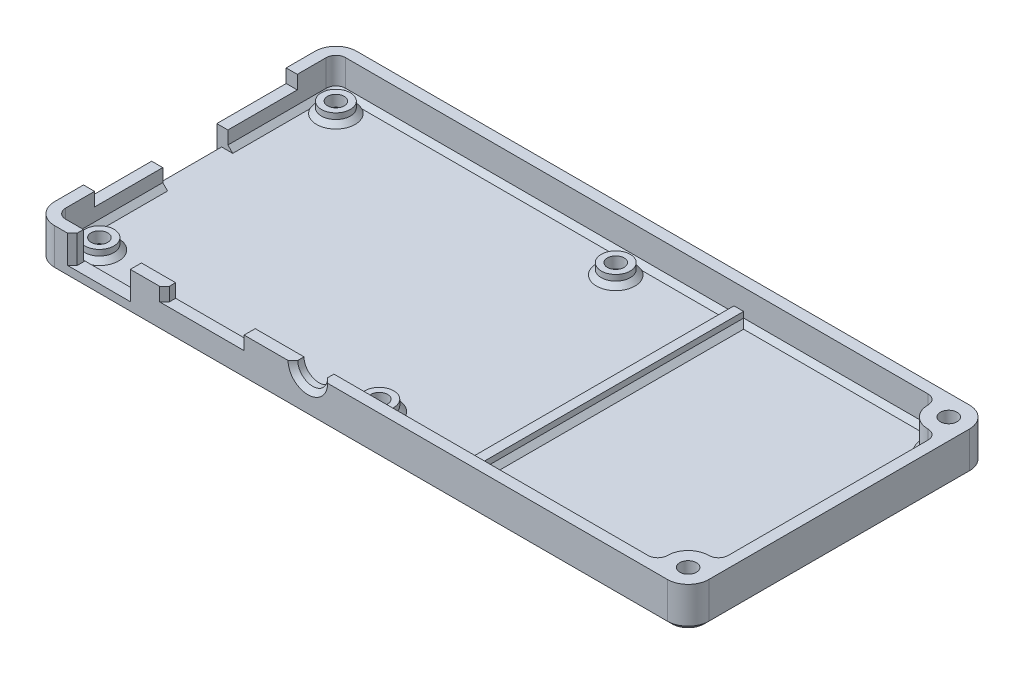
from build123d import *

# Parameters (mm, degrees)
SKETCH3_W                                         = 135.6
SKETCH3_H                                         = 62.6
SKETCH3_W_2                                       = 131
SKETCH3_H_2                                       = 58
BOSS_EXTRUDE1_DEPTH                               = 8.5
SKETCH5_W                                         = 131
SKETCH5_H                                         = 58
BOSS_EXTRUDE2_DEPTH                               = 2
SKETCH6_R                                         = 3
BOSS_EXTRUDE3_DEPTH                               = 2.2
SKETCH10_W                                        = 2
SKETCH10_H                                        = 58
BOSS_EXTRUDE4_DEPTH                               = 2.2
CUT_EXTRUDE1_REACH                                = 99.956
SKETCH11_R                                        = 3.1
SKETCH11_W                                        = 12
SKETCH11_H                                        = 5.8
SKETCH11_W_2                                      = 16.5
SKETCH11_H_2                                      = 2.8
CUT_EXTRUDE2_REACH                                = 142.155
SKETCH12_W                                        = 42
SKETCH12_H                                        = 2.8
SKETCH12_W_2                                      = 13.5
SKETCH12_H_2                                      = 3.7
FILLET6_R                                         = 2
FILLET8_R                                         = 2
CHAMFER1_SIZE                                     = 1
SKETCH24_R                                        = 4.3
BOSS_EXTRUDE7_DEPTH                               = 6.5
FILLET21_R                                        = 2
FILLET22_R                                        = 2
FILLET20_R                                        = 4.3
CHAMFER5_SIZE                                     = 1
CSK_FOR_4_FLAT_HEAD_SOCKET_CAP_SCREW1_D           = 3.4544
CSK_FOR_4_FLAT_HEAD_SOCKET_CAP_SCREW1_DEPTH       = 14
CSK_FOR_4_FLAT_HEAD_SOCKET_CAP_SCREW1_CSINK_D     = 6.723761
CSK_FOR_4_FLAT_HEAD_SOCKET_CAP_SCREW1_CSINK_ANGLE = 82
CSK_FOR_4_FLAT_HEAD_SOCKET_CAP_SCREW1_TIP         = 1.037806461
CHAMFER6_SIZE                                     = 1
CHAMFER7_SIZE                                     = 1
CHAMFER8_SIZE                                     = 1


# Some blends are built 0.0001 mm under size
with BuildPart() as part:
    # Sketch3 → Boss-Extrude1 (new body)
    with BuildSketch(Plane(origin=(0, 0, 0), x_dir=(1, 0, 0), z_dir=(0, 1, 0))):
        with Locations((-7.061766162, 3.105993834)):
            Rectangle(SKETCH3_W, SKETCH3_H)
        with Locations((-7.061766162, 3.105993834)):
            Rectangle(SKETCH3_W_2, SKETCH3_H_2, mode=Mode.SUBTRACT)
    extrude(amount=BOSS_EXTRUDE1_DEPTH)

    # Sketch5 → Boss-Extrude2 (add)
    with BuildSketch(Plane(origin=(0, 0, 0), x_dir=(1, 0, 0), z_dir=(0, 1, 0))):
        with Locations((-7.061766162, 3.105993834)):
            Rectangle(SKETCH5_W, SKETCH5_H)
    extrude(amount=BOSS_EXTRUDE2_DEPTH)

    # Sketch6 → Boss-Extrude3 (add)
    with BuildSketch(Plane(origin=(0, 2, 0), x_dir=(1, 0, 0), z_dir=(0, 1, 0))):
        with Locations(Location((-68.061766162, 27.605993834, 0), (0, 0, 270))):
            Circle(SKETCH6_R)
        with Locations(Location((-68.061766162, -21.394006166, 0), (0, 0, 270))):
            Circle(SKETCH6_R)
        with Locations(Location((-10.061766162, -21.394006166, 0), (0, 0, 270))):
            Circle(SKETCH6_R)
        with Locations(Location((-10.061766162, 27.605993834, 0), (0, 0, 270))):
            Circle(SKETCH6_R)
    extrude(amount=BOSS_EXTRUDE3_DEPTH)

    # Sketch10 → Boss-Extrude4 (add)
    with BuildSketch(Plane(origin=(0, 2, 0), x_dir=(1, 0, 0), z_dir=(0, 1, 0))):
        with Locations((10.938233838, 3.105993834)):
            Rectangle(SKETCH10_W, SKETCH10_H)
    extrude(amount=BOSS_EXTRUDE4_DEPTH)

    # Sketch11 → Cut-Extrude1 (cut, up to next)
    with BuildSketch(Plane.XY.offset(28.194006166), mode=Mode.PRIVATE) as cut_extrude1_sk1:
        with Locations((-18.061766162, 8.5)):
            Circle(SKETCH11_R)
    cut_extrude1_tool1 = extrude(cut_extrude1_sk1.sketch, amount=-CUT_EXTRUDE1_REACH, mode=Mode.PRIVATE) & part.part
    # Sketch11 → Cut-Extrude1 (cut, up to next)
    with BuildSketch(Plane.XY.offset(28.194006166), mode=Mode.PRIVATE) as cut_extrude1_sk2:
        with Locations((-60.861766162, 5.6)):
            Rectangle(SKETCH11_W, SKETCH11_H)
    cut_extrude1_tool2 = extrude(cut_extrude1_sk2.sketch, amount=-CUT_EXTRUDE1_REACH, mode=Mode.PRIVATE) & part.part
    # Sketch11 → Cut-Extrude1 (cut, up to next)
    with BuildSketch(Plane.XY.offset(28.194006166), mode=Mode.PRIVATE) as cut_extrude1_sk3:
        with Locations((-39.527982648, 7.1)):
            Rectangle(SKETCH11_W_2, SKETCH11_H_2)
    cut_extrude1_tool3 = extrude(cut_extrude1_sk3.sketch, amount=-CUT_EXTRUDE1_REACH, mode=Mode.PRIVATE) & part.part
    add(cut_extrude1_tool1.solids().sort_by_distance((-18.061766, 8.5, 28.194006))[0], mode=Mode.SUBTRACT)
    add(cut_extrude1_tool2.solids().sort_by_distance((-60.861766, 5.6, 28.194006))[0], mode=Mode.SUBTRACT)
    add(cut_extrude1_tool3.solids().sort_by_distance((-39.527983, 7.1, 28.194006))[0], mode=Mode.SUBTRACT)

    # Sketch12 → Cut-Extrude2 (cut, up to next)
    with BuildSketch(Plane.ZY.offset(74.861766162), mode=Mode.PRIVATE) as cut_extrude2_sk1:
        with Locations((-3.105993834, 7.1)):
            Rectangle(SKETCH12_W, SKETCH12_H)
    cut_extrude2_tool1 = extrude(cut_extrude2_sk1.sketch, amount=-CUT_EXTRUDE2_REACH, mode=Mode.PRIVATE) & part.part
    # Sketch12 → Cut-Extrude2 (cut, up to next)
    with BuildSketch(Plane.ZY.offset(74.861766162), mode=Mode.PRIVATE) as cut_extrude2_sk2:
        with Locations((-2.982922372, 3.85)):
            Rectangle(SKETCH12_W_2, SKETCH12_H_2)
    cut_extrude2_tool2 = extrude(cut_extrude2_sk2.sketch, amount=-CUT_EXTRUDE2_REACH, mode=Mode.PRIVATE) & part.part
    add(cut_extrude2_tool1.solids().sort_by_distance((-74.861766, 7.1, -3.105994))[0], mode=Mode.SUBTRACT)
    add(cut_extrude2_tool2.solids().sort_by_distance((-74.861766, 3.85, -2.982922))[0], mode=Mode.SUBTRACT)

    # Fillet6
    fillet6_edges = [part.edges().sort_by_distance(p)[0] for p in [
        (58.438233838, 5.25, -32.105993834),
    ]]
    fillet(fillet6_edges, radius=FILLET6_R)

    # Fillet8
    fillet8_edges = [part.edges().sort_by_distance(p)[0] for p in [
        (-72.561766162, 5.25, -32.105993834),
        (-72.561766162, 5.25, 25.894006166),
    ]]
    fillet(fillet8_edges, radius=FILLET8_R)

    # Chamfer1
    chamfer1_edges = [part.edges().sort_by_distance(p)[0] for p in [
        (-68.061766162, 2, -30.605993834),
        (-68.061766162, 2, 18.394006166),
        (-10.061766162, 2, 18.394006166),
        (-10.061766162, 2, -30.605993834),
    ]]
    chamfer(chamfer1_edges, length=CHAMFER1_SIZE)

    # Sketch24 → Boss-Extrude7 (add)
    with BuildSketch(Plane(origin=(0, 2, 0), x_dir=(1, 0, 0), z_dir=(0, 1, 0))):
        with Locations((56.438233838, -23.894006166)):
            Circle(SKETCH24_R)
        with Locations((56.438233838, 30.105993834)):
            Circle(SKETCH24_R)
    extrude(amount=BOSS_EXTRUDE7_DEPTH)

    # Fillet21
    fillet21_edges = [part.edges().sort_by_distance(p)[0] for p in [
        (52.631660576, 5.25, 25.894006166),
    ]]
    fillet(fillet21_edges, radius=FILLET21_R)

    # Fillet22
    fillet22_edges = [part.edges().sort_by_distance(p)[0] for p in [
        (58.438233838, 5.25, 20.087432904),
        (58.438233838, 5.25, -26.299420572),
        (52.631660576, 5.25, -32.105993834),
    ]]
    fillet(fillet22_edges, radius=FILLET22_R)

    # Fillet20
    fillet20_edges = [part.edges().sort_by_distance(p)[0] for p in [
        (-74.861766162, 4.25, -34.405993834),
        (60.738233838, 4.25, -34.405993834),
        (60.738233838, 4.25, 28.194006166),
        (-74.861766162, 4.25, 28.194006166),
    ]]
    fillet(fillet20_edges, radius=FILLET20_R - 0.0001)  # a hair under: the kernel refuses the full size

    # Chamfer5
    # the kernel refuses this chamfer: 1 mm, written as the material it adds along each edge
    with BuildSketch(Plane(origin=(-72.561766162, 2, 23.894006166), x_dir=(0.9996219169112968, -0.027495876610586605, 0), z_dir=(0, 0, -1))) as chamfer5_piece_1:
        Polygon((CHAMFER5_SIZE * 0.999621916911, -CHAMFER5_SIZE * 0.0274958766106), (-CHAMFER5_SIZE * 0.0274958766106, -CHAMFER5_SIZE * 0.999621916911), (0, 0), align=None)
    extrude(amount=20.126928538)
    with BuildSketch(Plane(origin=(-72.561766162, 2, -9.732922372), x_dir=(-0.02749587661058217, 0.9996219169112968, 0), z_dir=(0, 0, -1))) as chamfer5_piece_2:
        Polygon((CHAMFER5_SIZE * 0.999621916911, CHAMFER5_SIZE * 0.0274958766106), (-CHAMFER5_SIZE * 0.0274958766106, CHAMFER5_SIZE * 0.999621916911), (0, 0), align=None)
    extrude(amount=20.373071462)
    with BuildSketch(Plane(origin=(-70.561766162, 2, 23.894006166), x_dir=(0, 0, 1), z_dir=(1, 0, 0))) as chamfer5_piece_3:
        Polygon((2 - CHAMFER5_SIZE, 0), (2, -CHAMFER5_SIZE), (2, 0), align=None)
    revolve(axis=Axis((-70.561766162, 2, 23.894006166), (0, -1, 0)), revolution_arc=90)
    with BuildSketch(Plane(origin=(-70.561766162, 2, -30.105993834), x_dir=(0, 0, -1), z_dir=(1, 0, 0))) as chamfer5_piece_4:
        Polygon((2, CHAMFER5_SIZE), (2 - CHAMFER5_SIZE, 0), (2, 0), align=None)
    revolve(axis=Axis((-70.561766162, 2, -30.105993834), (0, 1, 0)), revolution_arc=90)
    with BuildSketch(Plane(origin=(12.509916826, 2, 25.894006166), x_dir=(0, 0.9996219169112968, 0.027495876610585623), z_dir=(-1, 0, 0))) as chamfer5_piece_5_section:
        Polygon((CHAMFER5_SIZE * 0.999621916911, CHAMFER5_SIZE * 0.0274958766106), (-CHAMFER5_SIZE * 0.0274958766106, CHAMFER5_SIZE * 0.999621916911), (0, 0), align=None)
    chamfer5_piece_5 = extrude(amount=83.071682988, mode=Mode.PRIVATE)
    chamfer5_piece_5 = split(chamfer5_piece_5, bisect_by=Plane(origin=(-54.861766162, 2.8, 25.794006166), z_dir=(1, 0, 0)), keep=Keep.TOP, mode=Mode.PRIVATE)
    add(chamfer5_piece_5)
    with BuildSketch(Plane(origin=(12.509916826, 2, 25.894006166), x_dir=(0, 0.9996219169112968, 0.027495876610585623), z_dir=(-1, 0, 0))) as chamfer5_piece_6_section:
        Polygon((CHAMFER5_SIZE * 0.999621916911, CHAMFER5_SIZE * 0.0274958766106), (-CHAMFER5_SIZE * 0.0274958766106, CHAMFER5_SIZE * 0.999621916911), (0, 0), align=None)
    chamfer5_piece_6 = extrude(amount=83.071682988, mode=Mode.PRIVATE)
    chamfer5_piece_6 = split(chamfer5_piece_6, bisect_by=Plane(origin=(-60.854561902, 2.7, 25.53824485), z_dir=(0, -1, 0)), keep=Keep.TOP, mode=Mode.PRIVATE)
    add(chamfer5_piece_6)
    with BuildSketch(Plane(origin=(12.509916826, 2, 25.894006166), x_dir=(0, 0.9996219169112968, 0.027495876610585623), z_dir=(-1, 0, 0))) as chamfer5_piece_7_section:
        Polygon((CHAMFER5_SIZE * 0.999621916911, CHAMFER5_SIZE * 0.0274958766106), (-CHAMFER5_SIZE * 0.0274958766106, CHAMFER5_SIZE * 0.999621916911), (0, 0), align=None)
    chamfer5_piece_7 = extrude(amount=83.071682988, mode=Mode.PRIVATE)
    chamfer5_piece_7 = split(chamfer5_piece_7, bisect_by=Plane(origin=(-66.861766162, 2.802568974, 25.79914411), z_dir=(-1, 0, 0)), keep=Keep.TOP, mode=Mode.PRIVATE)
    add(chamfer5_piece_7)
    with BuildSketch(Plane(origin=(-70.561766162, 2, -32.105993834), x_dir=(0, 0.9996219169112968, -0.027495876610589075), z_dir=(1, 0, 0))) as chamfer5_piece_8:
        Polygon((CHAMFER5_SIZE * 0.999621916911, CHAMFER5_SIZE * 0.0274958766106), (-CHAMFER5_SIZE * 0.0274958766106, CHAMFER5_SIZE * 0.999621916911), (0, 0), align=None)
    extrude(amount=83.071682988)
    with BuildSketch(Plane(origin=(9.938233838, 2, 25.894006166), x_dir=(0.027495876610585623, 0.9996219169112968, 0), z_dir=(0, 0, -1))) as chamfer5_piece_9:
        Polygon((CHAMFER5_SIZE * 0.999621916911, -CHAMFER5_SIZE * 0.0274958766106), (-CHAMFER5_SIZE * 0.0274958766106, -CHAMFER5_SIZE * 0.999621916911), (0, 0), align=None)
    extrude(amount=58)
    with BuildSketch(Plane(origin=(11.938233838, 2, -32.105993834), x_dir=(0.9996219169112968, -0.027495876610586296, 0), z_dir=(0, 0, 1))) as chamfer5_piece_10:
        Polygon((CHAMFER5_SIZE * 0.999621916911, CHAMFER5_SIZE * 0.0274958766106), (-CHAMFER5_SIZE * 0.0274958766106, CHAMFER5_SIZE * 0.999621916911), (0, 0), align=None)
    extrude(amount=58)
    with BuildSketch(Plane(origin=(9.36655085, 2, -32.105993834), x_dir=(0, 0.9996219169112968, -0.027495876610589075), z_dir=(1, 0, 0)), Plane(origin=(50.138233838, 2, 25.894006166), x_dir=(0, 0.9996219169112968, 0.027495876610585623), z_dir=(-1, 0, 0))) as chamfer5_piece_11:
        Polygon((CHAMFER5_SIZE * 0.999621916911, CHAMFER5_SIZE * 0.0274958766106), (-CHAMFER5_SIZE * 0.0274958766106, CHAMFER5_SIZE * 0.999621916911), (0, 0), align=None)
    extrude(amount=40.771682988)
    with BuildSketch(Plane(origin=(56.438233838, 2, 23.894006166), x_dir=(0, 0, -1), z_dir=(1, 0, 0))) as chamfer5_piece_12:
        Polygon((4.3, CHAMFER5_SIZE), (4.3 + CHAMFER5_SIZE, 0), (4.3, 0), align=None)
    revolve(axis=Axis((56.438233838, 2, 23.894006166), (0, 1, 0)), revolution_arc=90)
    with BuildSketch(Plane(origin=(58.438233838, 2, -23.805993834), x_dir=(0.02749587661059598, 0.9996219169112965, 0), z_dir=(0, 0, 1))) as chamfer5_piece_13:
        Polygon((CHAMFER5_SIZE * 0.999621916911, CHAMFER5_SIZE * 0.0274958766106), (-CHAMFER5_SIZE * 0.0274958766106, CHAMFER5_SIZE * 0.999621916911), (0, 0), align=None)
    extrude(amount=41.4)
    with BuildSketch(Plane(origin=(56.438233838, 2, -30.105993834), x_dir=(-1, 0, 0), z_dir=(0, 0, -1))) as chamfer5_piece_14:
        Polygon((4.3, CHAMFER5_SIZE), (4.3 + CHAMFER5_SIZE, 0), (4.3, 0), align=None)
    revolve(axis=Axis((56.438233838, 2, -30.105993834), (0, 1, 0)), revolution_arc=90)
    with BuildSketch(Plane(origin=(50.138233838, 2, 23.894006166), x_dir=(0, 0, 1), z_dir=(-1, 0, 0))) as chamfer5_piece_15:
        Polygon((2, CHAMFER5_SIZE), (2 - CHAMFER5_SIZE, 0), (2, 0), align=None)
    revolve(axis=Axis((50.138233838, 2, 23.894006166), (0, 1, 0)), revolution_arc=90)
    with BuildSketch(Plane(origin=(56.438233838, 2, 17.594006166), x_dir=(0, 0, 1), z_dir=(-1, 0, 0))) as chamfer5_piece_16:
        Polygon((2, CHAMFER5_SIZE), (2 - CHAMFER5_SIZE, 0), (2, 0), align=None)
    revolve(axis=Axis((56.438233838, 2, 17.594006166), (0, 1, 0)), revolution_arc=90)
    with BuildSketch(Plane(origin=(56.438233838, 2, -23.805993834), x_dir=(1, 0, 0), z_dir=(0, 0, 1))) as chamfer5_piece_17:
        Polygon((2, CHAMFER5_SIZE), (2 - CHAMFER5_SIZE, 0), (2, 0), align=None)
    revolve(axis=Axis((56.438233838, 2, -23.805993834), (0, 1, 0)), revolution_arc=90)
    with BuildSketch(Plane(origin=(50.138233838, 2, -30.105993834), x_dir=(0, 0, -1), z_dir=(-1, 0, 0))) as chamfer5_piece_18:
        Polygon((2, -CHAMFER5_SIZE), (2 - CHAMFER5_SIZE, 0), (2, 0), align=None)
    revolve(axis=Axis((50.138233838, 2, -30.105993834), (0, -1, 0)), revolution_arc=90)

    # CSK for #4 Flat Head Socket Cap Screw1
    with Locations(Plane(origin=(0, 0, 0), x_dir=(-1, 0, 0), z_dir=(0, -1, 0))):
        with Locations((68.061766162, 27.605993834), (68.061766162, -21.394006166), (-56.438233838, 30.105993834), (-56.438233838, -23.894006166), (10.061766162, -21.394006166), (10.061766162, 27.605993834)):
            CounterSinkHole(CSK_FOR_4_FLAT_HEAD_SOCKET_CAP_SCREW1_D / 2, CSK_FOR_4_FLAT_HEAD_SOCKET_CAP_SCREW1_CSINK_D / 2, depth=CSK_FOR_4_FLAT_HEAD_SOCKET_CAP_SCREW1_DEPTH, counter_sink_angle=CSK_FOR_4_FLAT_HEAD_SOCKET_CAP_SCREW1_CSINK_ANGLE)
            with Locations((0, 0, -(CSK_FOR_4_FLAT_HEAD_SOCKET_CAP_SCREW1_DEPTH + CSK_FOR_4_FLAT_HEAD_SOCKET_CAP_SCREW1_TIP / 2))):  # 118° drill point
                Cone(0, CSK_FOR_4_FLAT_HEAD_SOCKET_CAP_SCREW1_D / 2, CSK_FOR_4_FLAT_HEAD_SOCKET_CAP_SCREW1_TIP, mode=Mode.SUBTRACT)

    # Chamfer6
    chamfer6_edges = [part.edges().sort_by_distance(p)[0] for p in [
        (-18.061766162, 5.4, 28.194006166),
        (-66.861766162, 5.6, 28.194006166),
        (-47.777982648, 7.1, 28.194006166),
    ]]
    chamfer(chamfer6_edges, length=CHAMFER6_SIZE)

    # Chamfer7
    # the kernel refuses this chamfer: 1 mm, written as the material it takes off along each edge
    with BuildSketch(Plane(origin=(56.438333838, 0, -34.405993834), x_dir=(0, -0.027495876610586292, 0.9996219169112968), z_dir=(-1, 0, 0)), Plane(origin=(-70.561866162, 0, 28.194006166), x_dir=(0, -0.02749587661058639, -0.9996219169112968), z_dir=(1, 0, 0))) as chamfer7_piece_1:
        Polygon((CHAMFER7_SIZE * 0.999621916911, CHAMFER7_SIZE * 0.0274958766106), (-CHAMFER7_SIZE * 0.0274958766106, CHAMFER7_SIZE * 0.999621916911), (0, 0), align=None)
    extrude(amount=127.0002, mode=Mode.SUBTRACT)
    with BuildSketch(Plane(origin=(-74.861766162, 0, -30.106093834), x_dir=(0.9996219169112968, -0.027495876610586483, 0), z_dir=(0, 0, 1)), Plane(origin=(60.738233838, 0, 23.894106166), x_dir=(-0.9996219169112968, -0.027495876610586584, 0), z_dir=(0, 0, -1))) as chamfer7_piece_2:
        Polygon((CHAMFER7_SIZE * 0.999621916911, CHAMFER7_SIZE * 0.0274958766106), (-CHAMFER7_SIZE * 0.0274958766106, CHAMFER7_SIZE * 0.999621916911), (0, 0), align=None)
    extrude(amount=54.0002, mode=Mode.SUBTRACT)
    with BuildSketch(Plane(origin=(56.438333838, 0, 23.894106166), x_dir=(0, 0, 1), z_dir=(-1, 0, 0))) as chamfer7_piece_3:
        Polygon((4.2999 - CHAMFER7_SIZE, 0), (4.2999, CHAMFER7_SIZE), (4.2999, 0), align=None)
    revolve(axis=Axis((56.438333838, 0, 23.894106166), (0, 1, 0)), revolution_arc=90, mode=Mode.SUBTRACT)
    with BuildSketch(Plane(origin=(-70.561866162, 0, 23.894106166), x_dir=(0, 0, 1), z_dir=(1, 0, 0))) as chamfer7_piece_4:
        Polygon((4.2999 - CHAMFER7_SIZE, 0), (4.2999, -CHAMFER7_SIZE), (4.2999, 0), align=None)
    revolve(axis=Axis((-70.561866162, 0, 23.894106166), (0, -1, 0)), revolution_arc=90, mode=Mode.SUBTRACT)
    with BuildSketch(Plane(origin=(-70.561866162, 0, -30.106093834), x_dir=(0, 0, -1), z_dir=(1, 0, 0))) as chamfer7_piece_5:
        Polygon((4.2999 - CHAMFER7_SIZE, 0), (4.2999, CHAMFER7_SIZE), (4.2999, 0), align=None)
    revolve(axis=Axis((-70.561866162, 0, -30.106093834), (0, 1, 0)), revolution_arc=90, mode=Mode.SUBTRACT)
    with BuildSketch(Plane(origin=(56.438333838, 0, -30.106093834), x_dir=(1, 0, 0), z_dir=(0, 0, 1))) as chamfer7_piece_6:
        Polygon((4.2999 - CHAMFER7_SIZE, 0), (4.2999, CHAMFER7_SIZE), (4.2999, 0), align=None)
    revolve(axis=Axis((56.438333838, 0, -30.106093834), (0, 1, 0)), revolution_arc=90, mode=Mode.SUBTRACT)

    # Chamfer8
    chamfer8_edges = [part.edges().sort_by_distance(p)[0] for p in [
        (-74.861766162, 2, -2.982922372),
    ]]
    chamfer(chamfer8_edges, length=CHAMFER8_SIZE - 0.0001)  # a hair under: the kernel refuses the full size


solid = part.part
